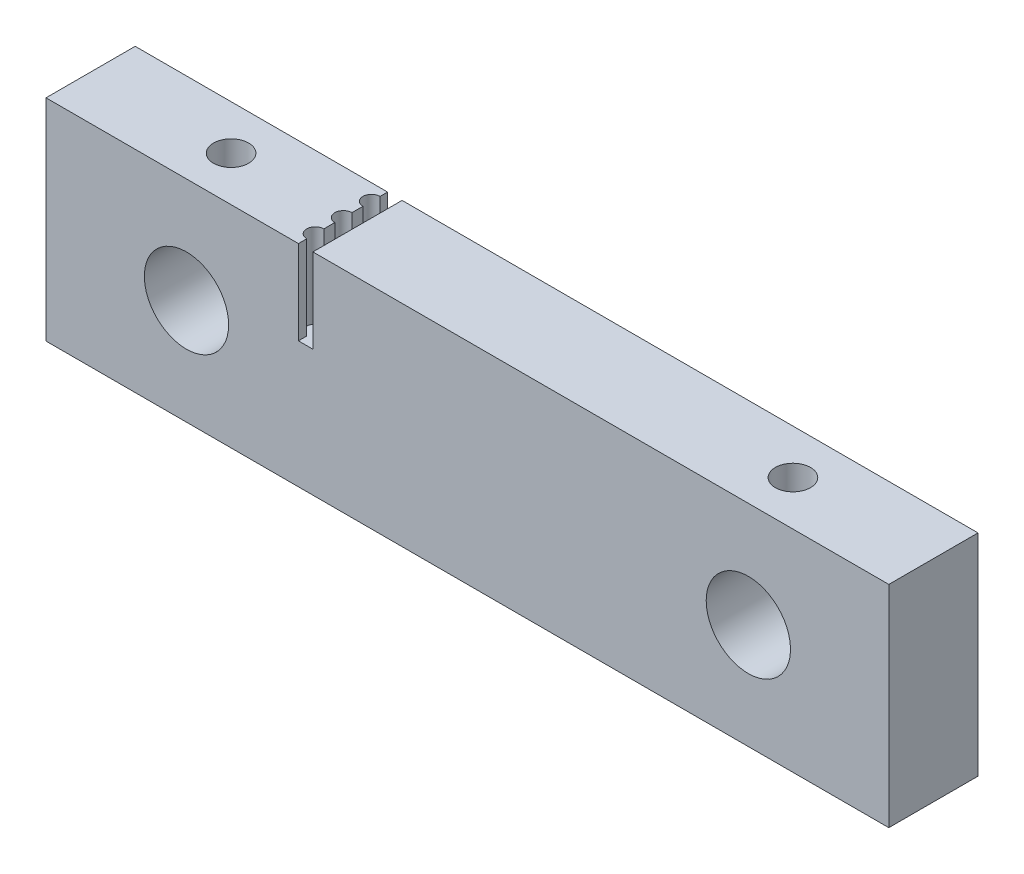
from build123d import *

# Parameters (mm, degrees)
SKETCH1_W             = 60
SKETCH1_H             = 15
SKETCH1_R             = 3
BOSS_EXTRUDE1_DEPTH   = 6.35
M3_TAPPED_HOLE1_D     = 2.5
M3_TAPPED_HOLE1_DEPTH = 8.5
M3_TAPPED_HOLE1_TIP   = 0.751075774
CUT_EXTRUDE1_DEPTH    = 6


with BuildPart() as part:
    # Sketch1 → Boss-Extrude1 (new body)
    with BuildSketch(Plane.XY):
        with Locations((30, 7.5)):
            Rectangle(SKETCH1_W, SKETCH1_H)
        with Locations((10, 7.5)):
            Circle(SKETCH1_R, mode=Mode.SUBTRACT)
        with Locations((50, 7.5)):
            Circle(SKETCH1_R, mode=Mode.SUBTRACT)
    extrude(amount=BOSS_EXTRUDE1_DEPTH)

    # M3 Tapped Hole1
    with Locations(Plane(origin=(0, 15, 0), x_dir=(-1, 0, 0), z_dir=(0, 1, 0))):
        with Locations((-10, 3.175), (-50, 3.175)):
            Hole(M3_TAPPED_HOLE1_D / 2, depth=M3_TAPPED_HOLE1_DEPTH)
            with Locations((0, 0, -(M3_TAPPED_HOLE1_DEPTH + M3_TAPPED_HOLE1_TIP / 2))):  # 118° drill point
                Cone(0, M3_TAPPED_HOLE1_D / 2, M3_TAPPED_HOLE1_TIP, mode=Mode.SUBTRACT)

    # Sketch5 → Cut-Extrude1 (cut)
    with BuildSketch(Plane(origin=(0, 15, 0), x_dir=(1, 0, 0), z_dir=(0, 1, 0))):
        with BuildLine():
            Line((19, -6.35), (19, 0))
            Line((19, 0), (17.97, 0))
            Line((17.97, 0), (17.97, -0.53745462))
            ThreePointArc((17.97, -0.53745462), (17.36, -1.14745462), (17.97, -1.75745462))
            Line((17.97, -1.75745462), (17.97, -2.53745462))
            ThreePointArc((17.97, -2.53745462), (17.36, -3.14745462), (17.97, -3.75745462))
            Line((17.97, -3.75745462), (17.97, -4.53745462))
            ThreePointArc((17.97, -4.53745462), (17.36, -5.14745462), (17.97, -5.75745462))
            Line((17.97, -5.75745462), (17.97, -6.35))
            Line((17.97, -6.35), (19, -6.35))
        make_face()
    extrude(amount=-CUT_EXTRUDE1_DEPTH, mode=Mode.SUBTRACT)


solid = part.part
